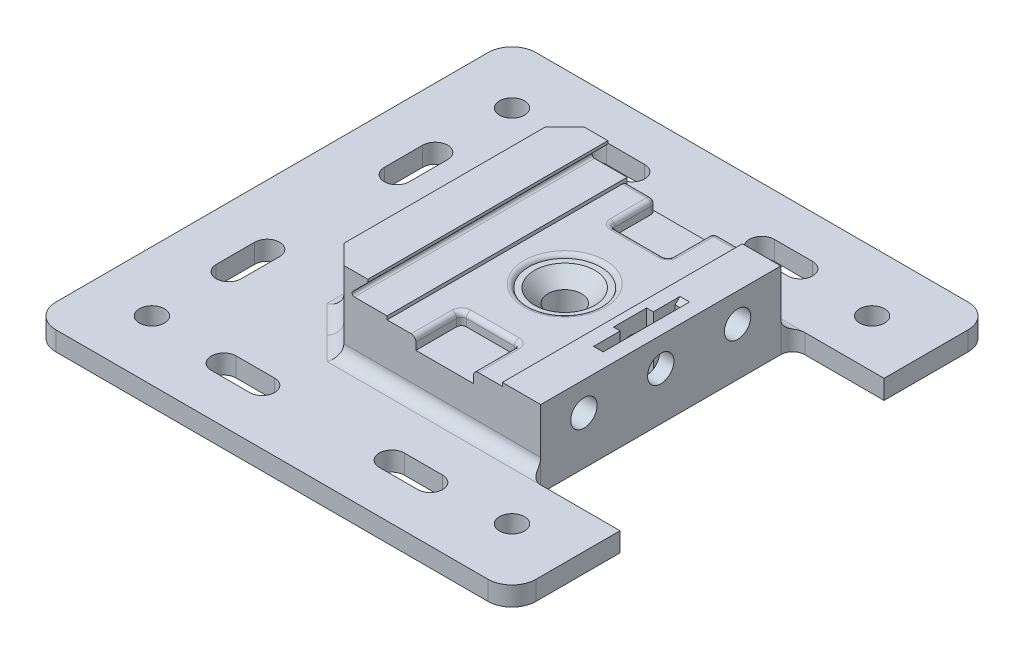
from build123d import *
from build123d.topology import SkipClean

# Parameters (mm, degrees)
SKETCH1_W                                       = 45
SKETCH1_H                                       = 50
BOSS_EXTRUDE1_DEPTH                             = 16
CUT_EXTRUDE1_DEPTH                              = 58.116109812
SKETCH4_W                                       = 24
SKETCH4_H                                       = 50
CUT_EXTRUDE2_DEPTH                              = 0.72
CUT_EXTRUDE3_DEPTH                              = 58.116109812
SKETCH8_R                                       = 7.5
CUT_EXTRUDE4_DEPTH                              = 0.72
CSK_FOR_M6_FLAT_HEAD_MACHINE_SCREW1_D           = 7
CSK_FOR_M6_FLAT_HEAD_MACHINE_SCREW1_CSINK_D     = 12.6
CSK_FOR_M6_FLAT_HEAD_MACHINE_SCREW1_CSINK_ANGLE = 90
CUT_EXTRUDE5_DEPTH                              = 2.5
FILLET1_R                                       = 1
FILLET2_R                                       = 1
FILLET4_R                                       = 0.5
CUT_EXTRUDE7_DEPTH                              = 11.5
SKETCH18_R                                      = 2.75
CUT_EXTRUDE8_DEPTH                              = 14.5
SKETCH19_R                                      = 2.75
CUT_EXTRUDE9_DEPTH                              = 10
SKETCH21_W                                      = 8.99
SKETCH21_H                                      = 50
BOSS_EXTRUDE2_DEPTH                             = 0.6
CHAMFER1_SIZE                                   = 4
CHAMFER2_SIZE                                   = 1
VESA75MOUNT_START                               = -28.858964805
VESA75MOUNT_OUTLINE_R                           = 2.6
VESA75MOUNT_DEPTH                               = 4
BODY_MOVE_COPY2_ANGLE                           = 120
CUT_EXTRUDE12_DEPTH                             = 10
SKETCH25_W                                      = 5
SKETCH25_H                                      = 42
BOSS_EXTRUDE3_DEPTH                             = 16.59
CHAMFER3_SIZE                                   = 5
FILLET7_R                                       = 2.5
FILLET8_R                                       = 2.5
CUT_EXTRUDE13_START                             = -10
SKETCH26_R                                      = 3.5
CUT_EXTRUDE13_DEPTH                             = 10


with BuildPart() as part:
    # Sketch1 → Boss-Extrude1 (new body)
    with BuildSketch(Plane(origin=(0, 0, 0), x_dir=(1, 0, 0), z_dir=(0, 1, 0))):
        Rectangle(SKETCH1_W, SKETCH1_H)
    extrude(amount=BOSS_EXTRUDE1_DEPTH)

    # Sketch3 → Cut-Extrude1 (cut, through all)
    with BuildSketch(Plane.XY.offset(25)):
        Polygon((-13.5, 16), (-17.5, 12), (22.5, 12), (22.5, 16), align=None)
    extrude(amount=-CUT_EXTRUDE1_DEPTH, mode=Mode.SUBTRACT)

    # Sketch4 → Cut-Extrude2 (cut)
    with BuildSketch(Plane(origin=(0, 12, 0), x_dir=(1, 0, 0), z_dir=(0, 1, 0))):
        with Locations((2.5, 0)):
            Rectangle(SKETCH4_W, SKETCH4_H)
    extrude(amount=-CUT_EXTRUDE2_DEPTH, mode=Mode.SUBTRACT)

    # Sketch5 → Cut-Extrude3 (cut, through all)
    with BuildSketch(Plane.XY.offset(25)):
        Polygon((-22.5, 16), (-13.5, 16), (-13.51, 15.99), (-22.5, 15.99), align=None)
    extrude(amount=-CUT_EXTRUDE3_DEPTH, mode=Mode.SUBTRACT)

    # Sketch8 → Cut-Extrude4 (cut)
    with BuildSketch(Plane(origin=(0, 11.28, 0), x_dir=(1, 0, 0), z_dir=(0, 1, 0))):
        with Locations(Location((2.5, 0, 0), (0, 0, 180))):
            Circle(SKETCH8_R)
    extrude(amount=-CUT_EXTRUDE4_DEPTH, mode=Mode.SUBTRACT)

    # CSK for M6 Flat Head Machine Screw1 (through all)
    with Locations(Plane(origin=(0, 10.56, 0), x_dir=(1, 0, 0), z_dir=(0, 1, 0))):
        with Locations((2.5, 0)):
            CounterSinkHole(CSK_FOR_M6_FLAT_HEAD_MACHINE_SCREW1_D / 2, CSK_FOR_M6_FLAT_HEAD_MACHINE_SCREW1_CSINK_D / 2, counter_sink_angle=CSK_FOR_M6_FLAT_HEAD_MACHINE_SCREW1_CSINK_ANGLE)

    # Sketch12 → Cut-Extrude5 (cut)
    with BuildSketch(Plane(origin=(0, 11.28, 0), x_dir=(1, 0, 0), z_dir=(0, 1, 0))):
        with BuildLine():
            Line((7.5, 15.5), (-2.5, 15.5))
            ThreePointArc((-2.5, 15.5), (-3.207106781, 15.792893219), (-3.5, 16.5))
            Line((-3.5, 16.5), (-3.5, 25))
            Line((-3.5, 25), (8.5, 25))
            Line((8.5, 25), (8.5, 16.5))
            ThreePointArc((8.5, 16.5), (8.207106781, 15.792893219), (7.5, 15.5))
        make_face()
    cut_extrude5 = extrude(amount=-CUT_EXTRUDE5_DEPTH, mode=Mode.SUBTRACT)

    # Fillet1
    fillet1_edges = [part.edges().sort_by_distance(p)[0] for p in [
        (-3.5, 10.03, -25),
        (8.5, 10.03, -25),
    ]]
    fillet(fillet1_edges, radius=FILLET1_R)

    # Mirror2: Cut-Extrude5 across plane
    add(cut_extrude5.mirror(Plane.XY), mode=Mode.SUBTRACT)

    # Fillet2
    # the kernel refuses this fillet: 1 mm, written as the material it takes off along each edge
    with BuildSketch(Plane(origin=(7.5, 11.28, 16.5), x_dir=(1, 0, 0), z_dir=(0, 0, 1))) as fillet2_piece_1:
        with BuildLine():
            CenterArc((1 + FILLET2_R, -FILLET2_R), FILLET2_R, 90, 90)
            Line((1, -FILLET2_R), (1 - FILLET2_R * 0.02, -FILLET2_R))
            Line((1 - FILLET2_R * 0.02, -FILLET2_R), (1 - FILLET2_R * 0.02, FILLET2_R * 0.02))
            Line((1 - FILLET2_R * 0.02, FILLET2_R * 0.02), (1 + FILLET2_R, FILLET2_R * 0.02))
            Line((1 + FILLET2_R, FILLET2_R * 0.02), (1 + FILLET2_R, 0))
        make_face()
    revolve(axis=Axis((7.5, 11.28, 16.5), (0, 1, 0)), revolution_arc=90, mode=Mode.SUBTRACT)
    with BuildSketch(Plane(origin=(8.5, 11.28, 27.5), x_dir=(1, 0, 0), z_dir=(0, 0, -1)), Plane(origin=(-3.5, 11.28, 16.5), x_dir=(-1, 0, 0), z_dir=(0, 0, 1))) as fillet2_piece_2:
        with BuildLine():
            CenterArc((FILLET2_R, FILLET2_R), FILLET2_R, 180, 90)
            Line((0, FILLET2_R), (-FILLET2_R * 0.02, FILLET2_R))
            Line((-FILLET2_R * 0.02, FILLET2_R), (-FILLET2_R * 0.02, -FILLET2_R * 0.02))
            Line((-FILLET2_R * 0.02, -FILLET2_R * 0.02), (FILLET2_R, -FILLET2_R * 0.02))
            Line((FILLET2_R, -FILLET2_R * 0.02), (FILLET2_R, 0))
        make_face()
    extrude(amount=11, mode=Mode.SUBTRACT)
    with BuildSketch(Plane(origin=(-2.5, 11.28, 16.5), x_dir=(0, 0, -1), z_dir=(1, 0, 0))) as fillet2_piece_3:
        with BuildLine():
            CenterArc((1 + FILLET2_R, -FILLET2_R), FILLET2_R, 90, 90)
            Line((1, -FILLET2_R), (1 - FILLET2_R * 0.02, -FILLET2_R))
            Line((1 - FILLET2_R * 0.02, -FILLET2_R), (1 - FILLET2_R * 0.02, FILLET2_R * 0.02))
            Line((1 - FILLET2_R * 0.02, FILLET2_R * 0.02), (1 + FILLET2_R, FILLET2_R * 0.02))
            Line((1 + FILLET2_R, FILLET2_R * 0.02), (1 + FILLET2_R, 0))
        make_face()
    revolve(axis=Axis((-2.5, 11.28, 16.5), (0, 1, 0)), revolution_arc=90, mode=Mode.SUBTRACT)
    with BuildSketch(Plane(origin=(7.5, 11.28, 15.5), x_dir=(0, 0, -1), z_dir=(-1, 0, 0))) as fillet2_piece_4:
        with BuildLine():
            CenterArc((FILLET2_R, FILLET2_R), FILLET2_R, 180, 90)
            Line((0, FILLET2_R), (-FILLET2_R * 0.02, FILLET2_R))
            Line((-FILLET2_R * 0.02, FILLET2_R), (-FILLET2_R * 0.02, -FILLET2_R * 0.02))
            Line((-FILLET2_R * 0.02, -FILLET2_R * 0.02), (FILLET2_R, -FILLET2_R * 0.02))
            Line((FILLET2_R, -FILLET2_R * 0.02), (FILLET2_R, 0))
        make_face()
    extrude(amount=10, mode=Mode.SUBTRACT)
    with BuildSketch(Plane(origin=(-4.5, 11.28, -25), x_dir=(0, 0, 1), z_dir=(-1, 0, 0)), Plane(origin=(14.5, 11.28, -25), x_dir=(0, 0, 1), z_dir=(-1, 0, 0))) as fillet2_piece_5:
        with BuildLine():
            CenterArc((FILLET2_R, -FILLET2_R), FILLET2_R, 90, 90)
            Line((0, -FILLET2_R), (-FILLET2_R * 0.02, -FILLET2_R))
            Line((-FILLET2_R * 0.02, -FILLET2_R), (-FILLET2_R * 0.02, FILLET2_R * 0.02))
            Line((-FILLET2_R * 0.02, FILLET2_R * 0.02), (FILLET2_R, FILLET2_R * 0.02))
            Line((FILLET2_R, FILLET2_R * 0.02), (FILLET2_R, 0))
        make_face()
    extrude(amount=5, mode=Mode.SUBTRACT)
    with BuildSketch(Plane(origin=(2.5, 11.28, 0), x_dir=(-1, 0, 0), z_dir=(0, 0, -1))) as fillet2_piece_6:
        with BuildLine():
            CenterArc((8.46, -1), FILLET2_R, 90, 73.739795292)
            Line((7.5, -0.72), (7.4808, -0.7144))
            ThreePointArc((7.4808, -0.7144), (7.48, -0.36), (7.48, 0))
            Line((7.48, 0), (7.5, 0.02))
            Line((7.5, 0.02), (8.46, 0.02))
            Line((8.46, 0.02), (8.46, 0))
        make_face()
    revolve(axis=Axis((2.5, 11.28, 0), (0, 1, 0)), mode=Mode.SUBTRACT)
    with BuildSketch(Plane(origin=(7.5, 11.28, -16.5), x_dir=(1, 0, 0), z_dir=(0, 0, -1))) as fillet2_piece_7:
        with BuildLine():
            CenterArc((1 + FILLET2_R, FILLET2_R), FILLET2_R, 180, 90)
            Line((1, FILLET2_R), (1 - FILLET2_R * 0.02, FILLET2_R))
            Line((1 - FILLET2_R * 0.02, FILLET2_R), (1 - FILLET2_R * 0.02, -FILLET2_R * 0.02))
            Line((1 - FILLET2_R * 0.02, -FILLET2_R * 0.02), (1 + FILLET2_R, -FILLET2_R * 0.02))
            Line((1 + FILLET2_R, -FILLET2_R * 0.02), (1 + FILLET2_R, 0))
        make_face()
    revolve(axis=Axis((7.5, 11.28, -16.5), (0, -1, 0)), revolution_arc=90, mode=Mode.SUBTRACT)
    with BuildSketch(Plane(origin=(8.5, 11.28, -24), x_dir=(1, 0, 0), z_dir=(0, 0, 1)), Plane(origin=(-3.5, 11.28, -16.5), x_dir=(-1, 0, 0), z_dir=(0, 0, -1))) as fillet2_piece_8:
        with BuildLine():
            CenterArc((FILLET2_R, -FILLET2_R), FILLET2_R, 90, 90)
            Line((0, -FILLET2_R), (-FILLET2_R * 0.02, -FILLET2_R))
            Line((-FILLET2_R * 0.02, -FILLET2_R), (-FILLET2_R * 0.02, FILLET2_R * 0.02))
            Line((-FILLET2_R * 0.02, FILLET2_R * 0.02), (FILLET2_R, FILLET2_R * 0.02))
            Line((FILLET2_R, FILLET2_R * 0.02), (FILLET2_R, 0))
        make_face()
    extrude(amount=7.5, mode=Mode.SUBTRACT)
    with BuildSketch(Plane(origin=(-2.5, 11.28, -16.5), x_dir=(0, 0, 1), z_dir=(1, 0, 0))) as fillet2_piece_9:
        with BuildLine():
            CenterArc((1 + FILLET2_R, FILLET2_R), FILLET2_R, 180, 90)
            Line((1, FILLET2_R), (1 - FILLET2_R * 0.02, FILLET2_R))
            Line((1 - FILLET2_R * 0.02, FILLET2_R), (1 - FILLET2_R * 0.02, -FILLET2_R * 0.02))
            Line((1 - FILLET2_R * 0.02, -FILLET2_R * 0.02), (1 + FILLET2_R, -FILLET2_R * 0.02))
            Line((1 + FILLET2_R, -FILLET2_R * 0.02), (1 + FILLET2_R, 0))
        make_face()
    revolve(axis=Axis((-2.5, 11.28, -16.5), (0, -1, 0)), revolution_arc=90, mode=Mode.SUBTRACT)
    with BuildSketch(Plane(origin=(7.5, 11.28, -15.5), x_dir=(0, 0, 1), z_dir=(-1, 0, 0))) as fillet2_piece_10:
        with BuildLine():
            CenterArc((FILLET2_R, -FILLET2_R), FILLET2_R, 90, 90)
            Line((0, -FILLET2_R), (-FILLET2_R * 0.02, -FILLET2_R))
            Line((-FILLET2_R * 0.02, -FILLET2_R), (-FILLET2_R * 0.02, FILLET2_R * 0.02))
            Line((-FILLET2_R * 0.02, FILLET2_R * 0.02), (FILLET2_R, FILLET2_R * 0.02))
            Line((FILLET2_R, FILLET2_R * 0.02), (FILLET2_R, 0))
        make_face()
    extrude(amount=10, mode=Mode.SUBTRACT)
    with BuildSketch(Plane(origin=(-4.5, 11.28, -24), x_dir=(0, 0, -1), z_dir=(-1, 0, 0))) as fillet2_piece_11:
        with BuildLine():
            CenterArc((1 - FILLET2_R, FILLET2_R), FILLET2_R, 270, 90)
            Line((1, FILLET2_R), (1 + FILLET2_R * 0.02, FILLET2_R))
            Line((1 + FILLET2_R * 0.02, FILLET2_R), (1 + FILLET2_R * 0.02, -FILLET2_R * 0.02))
            Line((1 + FILLET2_R * 0.02, -FILLET2_R * 0.02), (1 - FILLET2_R, -FILLET2_R * 0.02))
            Line((1 - FILLET2_R, -FILLET2_R * 0.02), (1 - FILLET2_R, 0))
        make_face()
    revolve(axis=Axis((-4.5, 11.28, -24), (0, -1, 0)), revolution_arc=90, mode=Mode.SUBTRACT)
    with BuildSketch(Plane(origin=(9.5, 11.28, -24), x_dir=(0, 0, -1), z_dir=(1, 0, 0))) as fillet2_piece_12:
        with BuildLine():
            CenterArc((1 - FILLET2_R, -FILLET2_R), FILLET2_R, 0, 90)
            Line((1, -FILLET2_R), (1 + FILLET2_R * 0.02, -FILLET2_R))
            Line((1 + FILLET2_R * 0.02, -FILLET2_R), (1 + FILLET2_R * 0.02, FILLET2_R * 0.02))
            Line((1 + FILLET2_R * 0.02, FILLET2_R * 0.02), (1 - FILLET2_R, FILLET2_R * 0.02))
            Line((1 - FILLET2_R, FILLET2_R * 0.02), (1 - FILLET2_R, 0))
        make_face()
    revolve(axis=Axis((9.5, 11.28, -24), (0, 1, 0)), revolution_arc=90, mode=Mode.SUBTRACT)

    # Fillet4
    fillet4_edges = [part.edges().sort_by_distance(p)[0] for p in [
        (-17.5, 12, 0),
    ]]
    fillet(fillet4_edges, radius=FILLET4_R)

    # Sketch14 → Cut-Extrude7 (cut)
    with BuildSketch(Plane(origin=(0, 12, 0), x_dir=(1, 0, 0), z_dir=(0, 1, 0))):
        Polygon((19.5, -8), (17.5, -8), (17.5, -3.45), (16.1, -3.45), (16.1, 3.45), (17.5, 3.45), (17.5, 8), (19.5, 8), align=None)
    extrude(amount=-CUT_EXTRUDE7_DEPTH, mode=Mode.SUBTRACT)

    # Sketch18 → Cut-Extrude8 (cut)
    with BuildSketch(Plane(origin=(22.5, 0, 0), x_dir=(0, 0, -1), z_dir=(1, 0, 0))):
        with Locations((0, 6)):
            Circle(SKETCH18_R)
    extrude(amount=-CUT_EXTRUDE8_DEPTH, mode=Mode.SUBTRACT)

    # Sketch19 → Cut-Extrude9 (cut)
    with BuildSketch(Plane(origin=(22.5, 0, 0), x_dir=(0, 0, -1), z_dir=(1, 0, 0))):
        with Locations((-16, 6)):
            Circle(SKETCH19_R)
        with Locations((16, 6)):
            Circle(SKETCH19_R)
    extrude(amount=-CUT_EXTRUDE9_DEPTH, mode=Mode.SUBTRACT)

    # Sketch21 → Boss-Extrude2 (add)
    with BuildSketch(Plane(origin=(0, 15.99, 0), x_dir=(1, 0, 0), z_dir=(0, 1, 0))):
        with Locations((-18.005, 0)):
            Rectangle(SKETCH21_W, SKETCH21_H)
    extrude(amount=BOSS_EXTRUDE2_DEPTH)

    # Chamfer1
    chamfer1_edges = [part.edges().sort_by_distance(p)[0] for p in [
        (-22.5, 8.295, 25),
        (-22.5, 8.295, -25),
    ]]
    chamfer(chamfer1_edges, length=CHAMFER1_SIZE)

    # Chamfer2
    chamfer2_edges = [part.edges().sort_by_distance(p)[0] for p in [
        (18.5, 12, 8),
        (18.5, 12, -8),
    ]]
    chamfer(chamfer2_edges, length=CHAMFER2_SIZE)


with BuildPart() as body_2:
    # VESA75mount: read off the stored shape, not the designer's step
    # VESA75mount outline → VESA75mount (new body)
    with BuildSketch(Plane.XY.offset(VESA75MOUNT_START)):
        with BuildLine():
            Line((48.628734023, 116.768459145), (31.128734023, 116.768459145))
            Line((31.128734023, 116.768459145), (31.128734023, 97.750486221))
            Line((31.128734023, 97.750486221), (-23.871265977, 97.750486221))
            Line((-23.871265977, 97.750486221), (-23.871265977, 116.768459145))
            Line((-23.871265977, 116.768459145), (-41.371265977, 116.768459145))
            ThreePointArc((-41.371265977, 116.768459145), (-44.906799883, 115.303993051), (-46.371265977, 111.768459145))
            Line((-46.371265977, 111.768459145), (-46.371265977, 21.768459145))
            ThreePointArc((-46.371265977, 21.768459145), (-44.906799883, 18.232925239), (-41.371265977, 16.768459145))
            Line((-41.371265977, 16.768459145), (48.628734023, 16.768459145))
            ThreePointArc((48.628734023, 16.768459145), (52.164267929, 18.232925239), (53.628734023, 21.768459145))
            Line((53.628734023, 21.768459145), (53.628734023, 111.768459145))
            ThreePointArc((53.628734023, 111.768459145), (52.164267929, 115.303993051), (48.628734023, 116.768459145))
        make_face()
        with Locations((-33.871265977, 29.268459145)):
            Circle(VESA75MOUNT_OUTLINE_R, mode=Mode.SUBTRACT)
        with Locations((41.128734023, 29.268459145)):
            Circle(VESA75MOUNT_OUTLINE_R, mode=Mode.SUBTRACT)
        with Locations((-33.871265977, 104.268459145)):
            Circle(VESA75MOUNT_OUTLINE_R, mode=Mode.SUBTRACT)
        with Locations((41.128734023, 104.268459145)):
            Circle(VESA75MOUNT_OUTLINE_R, mode=Mode.SUBTRACT)
    extrude(amount=VESA75MOUNT_DEPTH)


with BuildPart() as body_2_1:
    # Body-Move/Copy2: read off the stored shape, not the designer's step
    # Body-Move/Copy2: moved
    add(body_2.part.moved(Location((-3.628734, -75.2504862, 28.8589648))).rotate(Axis((0, 0, 0), (0.5773502692, 0.5773502692, -0.5773502692)), BODY_MOVE_COPY2_ANGLE))


with BuildPart() as part_1:
    add(part.part)

    # Combine1: union body 2
    add(body_2_1.part)

    # Sketch24 → Cut-Extrude12 (cut)
    with BuildSketch(Plane(origin=(0, 0, 0), x_dir=(1, 0, 0), z_dir=(0, 1, 0))):
        with BuildLine():
            Line((13.017972924, 35.937032247), (5.017972924, 35.937032247))
            ThreePointArc((5.017972924, 35.937032247), (2.417972924, 38.537032247), (5.017972924, 41.137032247))
            Line((5.017972924, 41.137032247), (13.017972924, 41.137032247))
            ThreePointArc((13.017972924, 41.137032247), (15.617972924, 38.537032247), (13.017972924, 35.937032247))
        make_face()
        with BuildLine():
            Line((-21.982027076, 35.937032247), (-29.982027076, 35.937032247))
            ThreePointArc((-29.982027076, 35.937032247), (-32.582027076, 38.537032247), (-29.982027076, 41.137032247))
            Line((-29.982027076, 41.137032247), (-21.982027076, 41.137032247))
            ThreePointArc((-21.982027076, 41.137032247), (-19.382027076, 38.537032247), (-21.982027076, 35.937032247))
        make_face()
        with BuildLine():
            Line((-43.382027076, 21.5), (-43.382027076, 13.5))
            ThreePointArc((-43.382027076, 13.5), (-45.982027076, 10.9), (-48.582027076, 13.5))
            Line((-48.582027076, 13.5), (-48.582027076, 21.5))
            ThreePointArc((-48.582027076, 21.5), (-45.982027076, 24.1), (-43.382027076, 21.5))
        make_face()
    cut_extrude12 = extrude(amount=-CUT_EXTRUDE12_DEPTH, mode=Mode.SUBTRACT)

    # Mirror3: Cut-Extrude12 across plane
    add(cut_extrude12.mirror(Plane.XY), mode=Mode.SUBTRACT)

    # Sketch25 → Boss-Extrude3 (add)
    with BuildSketch(Plane(origin=(0, 0, 0), x_dir=(1, 0, 0), z_dir=(0, 1, 0))):
        with Locations((-25, 0)):
            Rectangle(SKETCH25_W, SKETCH25_H)
    extrude(amount=BOSS_EXTRUDE3_DEPTH)

    # Chamfer3
    chamfer3_edges = [part_1.edges().sort_by_distance(p)[0] for p in [
        (-27.5, 8.295, 21),
        (-27.5, 8.295, -21),
        (-27.5, 16.59, 0),
    ]]
    chamfer(chamfer3_edges, length=CHAMFER3_SIZE - 0.0001)  # a hair under: the kernel refuses the full size

    # Fillet7
    fillet7_edges = [part_1.edges().sort_by_distance(p)[0] for p in [
        (-22.50005, 0, 21),
        (-25.00005, 5e-09, 18.50005),
        (-20.5, 0, 23),
        (-27.5, 0, 0),
        (2, 0, 25),
        (-25.00005, 5e-09, -18.50005),
        (-22.50005, 0, -21),
        (-20.5, 0, -23),
        (2, 0, -25),
    ]]
    fillet(fillet7_edges, radius=FILLET7_R)

    # Fillet8
    fillet8_edges = [part_1.edges().sort_by_distance(p)[0] for p in [
        (22.500000021, -1.999999995, 27.499999977),
        (22.500000021, -1.999999995, -27.500000023),
    ]]
    fillet(fillet8_edges, radius=FILLET8_R - 0.0001)  # a hair under: the kernel refuses the full size

    # Sketch26 → Cut-Extrude13 (cut)
    with SkipClean():  # the faces are left unmerged after this step: merging them gives an invalid solid
        with BuildSketch(Plane(origin=(0, 0, 0), x_dir=(1, 0, 0), z_dir=(0, 1, 0)).offset(CUT_EXTRUDE13_START)):
            with Locations(Location((2.5, 0, 0), (0, 0, 270))):
                Circle(SKETCH26_R)
        extrude(amount=CUT_EXTRUDE13_DEPTH, mode=Mode.SUBTRACT)


solid = part_1.part
